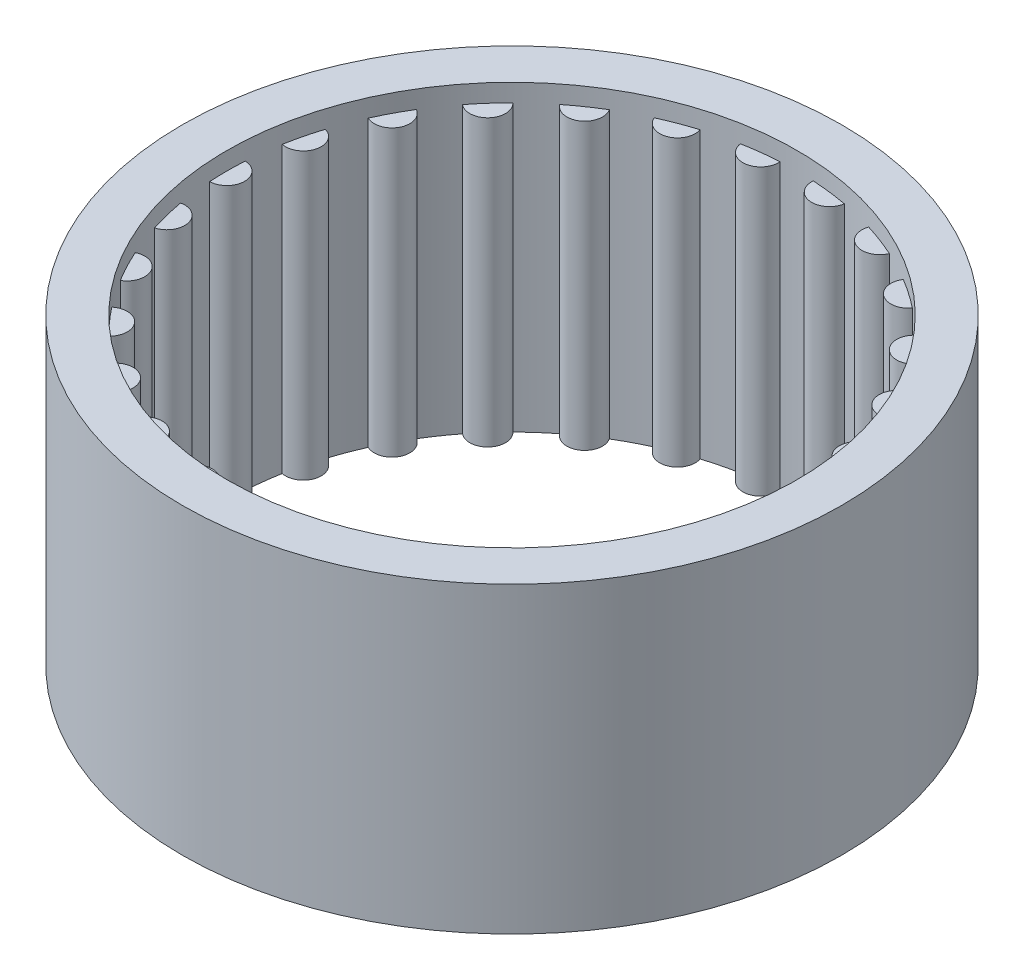
from build123d import *

# Parameters (mm, degrees)
BOSS_EXTRUDE1_DEPTH         = 8
BOSS_EXTRUDE1_DEPTH_BACK    = 8
SKETCH2_R                   = 1
BOSS_EXTRUDE1_2_DEPTH       = 8
BOSS_EXTRUDE1_2_DEPTH_BACK  = 8
BOSS_EXTRUDE1_3_DEPTH       = 8
BOSS_EXTRUDE1_3_DEPTH_BACK  = 8
BOSS_EXTRUDE1_4_DEPTH       = 8
BOSS_EXTRUDE1_4_DEPTH_BACK  = 8
BOSS_EXTRUDE1_5_DEPTH       = 8
BOSS_EXTRUDE1_5_DEPTH_BACK  = 8
BOSS_EXTRUDE1_6_DEPTH       = 8
BOSS_EXTRUDE1_6_DEPTH_BACK  = 8
BOSS_EXTRUDE1_7_DEPTH       = 8
BOSS_EXTRUDE1_7_DEPTH_BACK  = 8
BOSS_EXTRUDE1_8_DEPTH       = 8
BOSS_EXTRUDE1_8_DEPTH_BACK  = 8
BOSS_EXTRUDE1_9_DEPTH       = 8
BOSS_EXTRUDE1_9_DEPTH_BACK  = 8
BOSS_EXTRUDE1_10_DEPTH      = 8
BOSS_EXTRUDE1_10_DEPTH_BACK = 8
BOSS_EXTRUDE1_11_DEPTH      = 8
BOSS_EXTRUDE1_11_DEPTH_BACK = 8
BOSS_EXTRUDE1_12_DEPTH      = 8
BOSS_EXTRUDE1_12_DEPTH_BACK = 8
BOSS_EXTRUDE1_13_DEPTH      = 8
BOSS_EXTRUDE1_13_DEPTH_BACK = 8
BOSS_EXTRUDE1_14_DEPTH      = 8
BOSS_EXTRUDE1_14_DEPTH_BACK = 8
BOSS_EXTRUDE1_15_DEPTH      = 8
BOSS_EXTRUDE1_15_DEPTH_BACK = 8
BOSS_EXTRUDE1_16_DEPTH      = 8
BOSS_EXTRUDE1_16_DEPTH_BACK = 8
BOSS_EXTRUDE1_17_DEPTH      = 8
BOSS_EXTRUDE1_17_DEPTH_BACK = 8
BOSS_EXTRUDE1_18_DEPTH      = 8
BOSS_EXTRUDE1_18_DEPTH_BACK = 8
BOSS_EXTRUDE1_19_DEPTH      = 8
BOSS_EXTRUDE1_19_DEPTH_BACK = 8
BOSS_EXTRUDE1_20_DEPTH      = 8
BOSS_EXTRUDE1_20_DEPTH_BACK = 8
BOSS_EXTRUDE1_21_DEPTH      = 8
BOSS_EXTRUDE1_21_DEPTH_BACK = 8
BOSS_EXTRUDE1_22_DEPTH      = 8
BOSS_EXTRUDE1_22_DEPTH_BACK = 8
BOSS_EXTRUDE1_23_DEPTH      = 8
BOSS_EXTRUDE1_23_DEPTH_BACK = 8
BOSS_EXTRUDE1_24_DEPTH      = 8
BOSS_EXTRUDE1_24_DEPTH_BACK = 8
BOSS_EXTRUDE1_25_DEPTH      = 8
BOSS_EXTRUDE1_25_DEPTH_BACK = 8
BOSS_EXTRUDE1_26_DEPTH      = 8
BOSS_EXTRUDE1_26_DEPTH_BACK = 8
BOSS_EXTRUDE3_DEPTH         = 8
BOSS_EXTRUDE3_DEPTH_BACK    = 8
SKETCH5_R                   = 18.5
SKETCH5_R_2                 = 16
SKETCH6_R                   = 18.5
SKETCH6_R_2                 = 16
BOSS_EXTRUDE4_DEPTH         = 1


with BuildPart() as part:
    # Sketch2 → Boss-Extrude1 (new, two sides: drawn at the far end of the back side and taken through both)
    with BuildSketch(Plane(origin=(0, 0, 0), x_dir=(1, 0, 0), z_dir=(0, 1, 0)).offset(-BOSS_EXTRUDE1_DEPTH_BACK)):
        with Locations((15.5, 0)):
            Circle(SKETCH2_R)
    extrude(amount=BOSS_EXTRUDE1_DEPTH + BOSS_EXTRUDE1_DEPTH_BACK)



with BuildPart() as body_2:
    # Sketch2 → Boss-Extrude1 2 (new, two sides: drawn at the far end of the back side and taken through both)
    with BuildSketch(Plane(origin=(0, 0, 0), x_dir=(1, 0, 0), z_dir=(0, 1, 0)).offset(-BOSS_EXTRUDE1_2_DEPTH_BACK)):
        with Locations((15.035069079, -3.829050629)):
            Circle(SKETCH2_R)
    extrude(amount=BOSS_EXTRUDE1_2_DEPTH + BOSS_EXTRUDE1_2_DEPTH_BACK)


with BuildPart() as body_3:
    # Sketch2 → Boss-Extrude1 3 (new, two sides: drawn at the far end of the back side and taken through both)
    with BuildSketch(Plane(origin=(0, 0, 0), x_dir=(1, 0, 0), z_dir=(0, 1, 0)).offset(-BOSS_EXTRUDE1_3_DEPTH_BACK)):
        with Locations((13.66729641, -7.435570753)):
            Circle(SKETCH2_R)
    extrude(amount=BOSS_EXTRUDE1_3_DEPTH + BOSS_EXTRUDE1_3_DEPTH_BACK)


with BuildPart() as body_4:
    # Sketch2 → Boss-Extrude1 4 (new, two sides: drawn at the far end of the back side and taken through both)
    with BuildSketch(Plane(origin=(0, 0, 0), x_dir=(1, 0, 0), z_dir=(0, 1, 0)).offset(-BOSS_EXTRUDE1_4_DEPTH_BACK)):
        with Locations((11.476171971, -10.609962532)):
            Circle(SKETCH2_R)
    extrude(amount=BOSS_EXTRUDE1_4_DEPTH + BOSS_EXTRUDE1_4_DEPTH_BACK)


with BuildPart() as body_5:
    # Sketch2 → Boss-Extrude1 5 (new, two sides: drawn at the far end of the back side and taken through both)
    with BuildSketch(Plane(origin=(0, 0, 0), x_dir=(1, 0, 0), z_dir=(0, 1, 0)).offset(-BOSS_EXTRUDE1_5_DEPTH_BACK)):
        with Locations((8.589035948, -13.167741854)):
            Circle(SKETCH2_R)
    extrude(amount=BOSS_EXTRUDE1_5_DEPTH + BOSS_EXTRUDE1_5_DEPTH_BACK)


with BuildPart() as body_6:
    # Sketch2 → Boss-Extrude1 6 (new, two sides: drawn at the far end of the back side and taken through both)
    with BuildSketch(Plane(origin=(0, 0, 0), x_dir=(1, 0, 0), z_dir=(0, 1, 0)).offset(-BOSS_EXTRUDE1_6_DEPTH_BACK)):
        with Locations((5.173678193, -14.960259883)):
            Circle(SKETCH2_R)
    extrude(amount=BOSS_EXTRUDE1_6_DEPTH + BOSS_EXTRUDE1_6_DEPTH_BACK)


with BuildPart() as body_7:
    # Sketch2 → Boss-Extrude1 7 (new, two sides: drawn at the far end of the back side and taken through both)
    with BuildSketch(Plane(origin=(0, 0, 0), x_dir=(1, 0, 0), z_dir=(0, 1, 0)).offset(-BOSS_EXTRUDE1_7_DEPTH_BACK)):
        with Locations((1.428586884, -15.883341986)):
            Circle(SKETCH2_R)
    extrude(amount=BOSS_EXTRUDE1_7_DEPTH + BOSS_EXTRUDE1_7_DEPTH_BACK)


with BuildPart() as body_8:
    # Sketch2 → Boss-Extrude1 8 (new, two sides: drawn at the far end of the back side and taken through both)
    with BuildSketch(Plane(origin=(0, 0, 0), x_dir=(1, 0, 0), z_dir=(0, 1, 0)).offset(-BOSS_EXTRUDE1_8_DEPTH_BACK)):
        with Locations((-2.428586884, -15.883341986)):
            Circle(SKETCH2_R)
    extrude(amount=BOSS_EXTRUDE1_8_DEPTH + BOSS_EXTRUDE1_8_DEPTH_BACK)


with BuildPart() as body_9:
    # Sketch2 → Boss-Extrude1 9 (new, two sides: drawn at the far end of the back side and taken through both)
    with BuildSketch(Plane(origin=(0, 0, 0), x_dir=(1, 0, 0), z_dir=(0, 1, 0)).offset(-BOSS_EXTRUDE1_9_DEPTH_BACK)):
        with Locations((-6.173678193, -14.960259883)):
            Circle(SKETCH2_R)
    extrude(amount=BOSS_EXTRUDE1_9_DEPTH + BOSS_EXTRUDE1_9_DEPTH_BACK)


with BuildPart() as body_10:
    # Sketch2 → Boss-Extrude1 10 (new, two sides: drawn at the far end of the back side and taken through both)
    with BuildSketch(Plane(origin=(0, 0, 0), x_dir=(1, 0, 0), z_dir=(0, 1, 0)).offset(-BOSS_EXTRUDE1_10_DEPTH_BACK)):
        with Locations((-9.589035948, -13.167741854)):
            Circle(SKETCH2_R)
    extrude(amount=BOSS_EXTRUDE1_10_DEPTH + BOSS_EXTRUDE1_10_DEPTH_BACK)


with BuildPart() as body_11:
    # Sketch2 → Boss-Extrude1 11 (new, two sides: drawn at the far end of the back side and taken through both)
    with BuildSketch(Plane(origin=(0, 0, 0), x_dir=(1, 0, 0), z_dir=(0, 1, 0)).offset(-BOSS_EXTRUDE1_11_DEPTH_BACK)):
        with Locations((-12.476171971, -10.609962532)):
            Circle(SKETCH2_R)
    extrude(amount=BOSS_EXTRUDE1_11_DEPTH + BOSS_EXTRUDE1_11_DEPTH_BACK)


with BuildPart() as body_12:
    # Sketch2 → Boss-Extrude1 12 (new, two sides: drawn at the far end of the back side and taken through both)
    with BuildSketch(Plane(origin=(0, 0, 0), x_dir=(1, 0, 0), z_dir=(0, 1, 0)).offset(-BOSS_EXTRUDE1_12_DEPTH_BACK)):
        with Locations((-14.66729641, -7.435570753)):
            Circle(SKETCH2_R)
    extrude(amount=BOSS_EXTRUDE1_12_DEPTH + BOSS_EXTRUDE1_12_DEPTH_BACK)


with BuildPart() as body_13:
    # Sketch2 → Boss-Extrude1 13 (new, two sides: drawn at the far end of the back side and taken through both)
    with BuildSketch(Plane(origin=(0, 0, 0), x_dir=(1, 0, 0), z_dir=(0, 1, 0)).offset(-BOSS_EXTRUDE1_13_DEPTH_BACK)):
        with Locations((-16.035069079, -3.829050629)):
            Circle(SKETCH2_R)
    extrude(amount=BOSS_EXTRUDE1_13_DEPTH + BOSS_EXTRUDE1_13_DEPTH_BACK)


with BuildPart() as body_14:
    # Sketch2 → Boss-Extrude1 14 (new, two sides: drawn at the far end of the back side and taken through both)
    with BuildSketch(Plane(origin=(0, 0, 0), x_dir=(1, 0, 0), z_dir=(0, 1, 0)).offset(-BOSS_EXTRUDE1_14_DEPTH_BACK)):
        with Locations((-16.5, 0)):
            Circle(SKETCH2_R)
    extrude(amount=BOSS_EXTRUDE1_14_DEPTH + BOSS_EXTRUDE1_14_DEPTH_BACK)


with BuildPart() as body_15:
    # Sketch2 → Boss-Extrude1 15 (new, two sides: drawn at the far end of the back side and taken through both)
    with BuildSketch(Plane(origin=(0, 0, 0), x_dir=(1, 0, 0), z_dir=(0, 1, 0)).offset(-BOSS_EXTRUDE1_15_DEPTH_BACK)):
        with Locations((-16.035069079, 3.829050629)):
            Circle(SKETCH2_R)
    extrude(amount=BOSS_EXTRUDE1_15_DEPTH + BOSS_EXTRUDE1_15_DEPTH_BACK)


with BuildPart() as body_16:
    # Sketch2 → Boss-Extrude1 16 (new, two sides: drawn at the far end of the back side and taken through both)
    with BuildSketch(Plane(origin=(0, 0, 0), x_dir=(1, 0, 0), z_dir=(0, 1, 0)).offset(-BOSS_EXTRUDE1_16_DEPTH_BACK)):
        with Locations((-14.66729641, 7.435570753)):
            Circle(SKETCH2_R)
    extrude(amount=BOSS_EXTRUDE1_16_DEPTH + BOSS_EXTRUDE1_16_DEPTH_BACK)


with BuildPart() as body_17:
    # Sketch2 → Boss-Extrude1 17 (new, two sides: drawn at the far end of the back side and taken through both)
    with BuildSketch(Plane(origin=(0, 0, 0), x_dir=(1, 0, 0), z_dir=(0, 1, 0)).offset(-BOSS_EXTRUDE1_17_DEPTH_BACK)):
        with Locations((-12.476171971, 10.609962532)):
            Circle(SKETCH2_R)
    extrude(amount=BOSS_EXTRUDE1_17_DEPTH + BOSS_EXTRUDE1_17_DEPTH_BACK)


with BuildPart() as body_18:
    # Sketch2 → Boss-Extrude1 18 (new, two sides: drawn at the far end of the back side and taken through both)
    with BuildSketch(Plane(origin=(0, 0, 0), x_dir=(1, 0, 0), z_dir=(0, 1, 0)).offset(-BOSS_EXTRUDE1_18_DEPTH_BACK)):
        with Locations((-9.589035948, 13.167741854)):
            Circle(SKETCH2_R)
    extrude(amount=BOSS_EXTRUDE1_18_DEPTH + BOSS_EXTRUDE1_18_DEPTH_BACK)


with BuildPart() as body_19:
    # Sketch2 → Boss-Extrude1 19 (new, two sides: drawn at the far end of the back side and taken through both)
    with BuildSketch(Plane(origin=(0, 0, 0), x_dir=(1, 0, 0), z_dir=(0, 1, 0)).offset(-BOSS_EXTRUDE1_19_DEPTH_BACK)):
        with Locations((-6.173678193, 14.960259883)):
            Circle(SKETCH2_R)
    extrude(amount=BOSS_EXTRUDE1_19_DEPTH + BOSS_EXTRUDE1_19_DEPTH_BACK)


with BuildPart() as body_20:
    # Sketch2 → Boss-Extrude1 20 (new, two sides: drawn at the far end of the back side and taken through both)
    with BuildSketch(Plane(origin=(0, 0, 0), x_dir=(1, 0, 0), z_dir=(0, 1, 0)).offset(-BOSS_EXTRUDE1_20_DEPTH_BACK)):
        with Locations((-2.428586884, 15.883341986)):
            Circle(SKETCH2_R)
    extrude(amount=BOSS_EXTRUDE1_20_DEPTH + BOSS_EXTRUDE1_20_DEPTH_BACK)


with BuildPart() as body_21:
    # Sketch2 → Boss-Extrude1 21 (new, two sides: drawn at the far end of the back side and taken through both)
    with BuildSketch(Plane(origin=(0, 0, 0), x_dir=(1, 0, 0), z_dir=(0, 1, 0)).offset(-BOSS_EXTRUDE1_21_DEPTH_BACK)):
        with Locations((1.428586884, 15.883341986)):
            Circle(SKETCH2_R)
    extrude(amount=BOSS_EXTRUDE1_21_DEPTH + BOSS_EXTRUDE1_21_DEPTH_BACK)


with BuildPart() as body_22:
    # Sketch2 → Boss-Extrude1 22 (new, two sides: drawn at the far end of the back side and taken through both)
    with BuildSketch(Plane(origin=(0, 0, 0), x_dir=(1, 0, 0), z_dir=(0, 1, 0)).offset(-BOSS_EXTRUDE1_22_DEPTH_BACK)):
        with Locations((5.173678193, 14.960259883)):
            Circle(SKETCH2_R)
    extrude(amount=BOSS_EXTRUDE1_22_DEPTH + BOSS_EXTRUDE1_22_DEPTH_BACK)


with BuildPart() as body_23:
    # Sketch2 → Boss-Extrude1 23 (new, two sides: drawn at the far end of the back side and taken through both)
    with BuildSketch(Plane(origin=(0, 0, 0), x_dir=(1, 0, 0), z_dir=(0, 1, 0)).offset(-BOSS_EXTRUDE1_23_DEPTH_BACK)):
        with Locations((8.589035948, 13.167741854)):
            Circle(SKETCH2_R)
    extrude(amount=BOSS_EXTRUDE1_23_DEPTH + BOSS_EXTRUDE1_23_DEPTH_BACK)


with BuildPart() as body_24:
    # Sketch2 → Boss-Extrude1 24 (new, two sides: drawn at the far end of the back side and taken through both)
    with BuildSketch(Plane(origin=(0, 0, 0), x_dir=(1, 0, 0), z_dir=(0, 1, 0)).offset(-BOSS_EXTRUDE1_24_DEPTH_BACK)):
        with Locations((11.476171971, 10.609962532)):
            Circle(SKETCH2_R)
    extrude(amount=BOSS_EXTRUDE1_24_DEPTH + BOSS_EXTRUDE1_24_DEPTH_BACK)


with BuildPart() as body_25:
    # Sketch2 → Boss-Extrude1 25 (new, two sides: drawn at the far end of the back side and taken through both)
    with BuildSketch(Plane(origin=(0, 0, 0), x_dir=(1, 0, 0), z_dir=(0, 1, 0)).offset(-BOSS_EXTRUDE1_25_DEPTH_BACK)):
        with Locations((13.66729641, 7.435570753)):
            Circle(SKETCH2_R)
    extrude(amount=BOSS_EXTRUDE1_25_DEPTH + BOSS_EXTRUDE1_25_DEPTH_BACK)


with BuildPart() as body_26:
    # Sketch2 → Boss-Extrude1 26 (new, two sides: drawn at the far end of the back side and taken through both)
    with BuildSketch(Plane(origin=(0, 0, 0), x_dir=(1, 0, 0), z_dir=(0, 1, 0)).offset(-BOSS_EXTRUDE1_26_DEPTH_BACK)):
        with Locations((15.035069079, 3.829050629)):
            Circle(SKETCH2_R)
    extrude(amount=BOSS_EXTRUDE1_26_DEPTH + BOSS_EXTRUDE1_26_DEPTH_BACK)


with BuildPart() as part_1:
    add(part.part)

    add(body_2.part)  # Boss-Extrude3 merges body 2

    add(body_3.part)  # Boss-Extrude3 merges body 3

    add(body_4.part)  # Boss-Extrude3 merges body 4

    add(body_5.part)  # Boss-Extrude3 merges body 5

    add(body_6.part)  # Boss-Extrude3 merges body 6

    add(body_7.part)  # Boss-Extrude3 merges body 7

    add(body_8.part)  # Boss-Extrude3 merges body 8

    add(body_9.part)  # Boss-Extrude3 merges body 9

    add(body_10.part)  # Boss-Extrude3 merges body 10

    add(body_11.part)  # Boss-Extrude3 merges body 11

    add(body_12.part)  # Boss-Extrude3 merges body 12

    add(body_13.part)  # Boss-Extrude3 merges body 13

    add(body_14.part)  # Boss-Extrude3 merges body 14

    add(body_15.part)  # Boss-Extrude3 merges body 15

    add(body_16.part)  # Boss-Extrude3 merges body 16

    add(body_17.part)  # Boss-Extrude3 merges body 17

    add(body_18.part)  # Boss-Extrude3 merges body 18

    add(body_19.part)  # Boss-Extrude3 merges body 19

    add(body_20.part)  # Boss-Extrude3 merges body 20

    add(body_21.part)  # Boss-Extrude3 merges body 21

    add(body_22.part)  # Boss-Extrude3 merges body 22

    add(body_23.part)  # Boss-Extrude3 merges body 23

    add(body_24.part)  # Boss-Extrude3 merges body 24

    add(body_25.part)  # Boss-Extrude3 merges body 25

    add(body_26.part)  # Boss-Extrude3 merges body 26
    # Sketch5 → Boss-Extrude3 (add, two sides: drawn at the far end of the back side and taken through both)
    with BuildSketch(Plane(origin=(0, 0, 0), x_dir=(1, 0, 0), z_dir=(0, 1, 0)).offset(-BOSS_EXTRUDE3_DEPTH_BACK)):
        with Locations((-0.5, 0)):
            Circle(SKETCH5_R)
        with Locations((-0.5, 0)):
            Circle(SKETCH5_R_2, mode=Mode.SUBTRACT)
    extrude(amount=BOSS_EXTRUDE3_DEPTH + BOSS_EXTRUDE3_DEPTH_BACK)

    # Sketch6 → Boss-Extrude4 (add)
    with BuildSketch(Plane(origin=(0, 8, 0), x_dir=(1, 0, 0), z_dir=(0, 1, 0))):
        with Locations((-0.5, 0)):
            Circle(SKETCH6_R)
        with Locations((-0.5, 0)):
            Circle(SKETCH6_R_2, mode=Mode.SUBTRACT)
    extrude(amount=BOSS_EXTRUDE4_DEPTH)


solid = part_1.part
